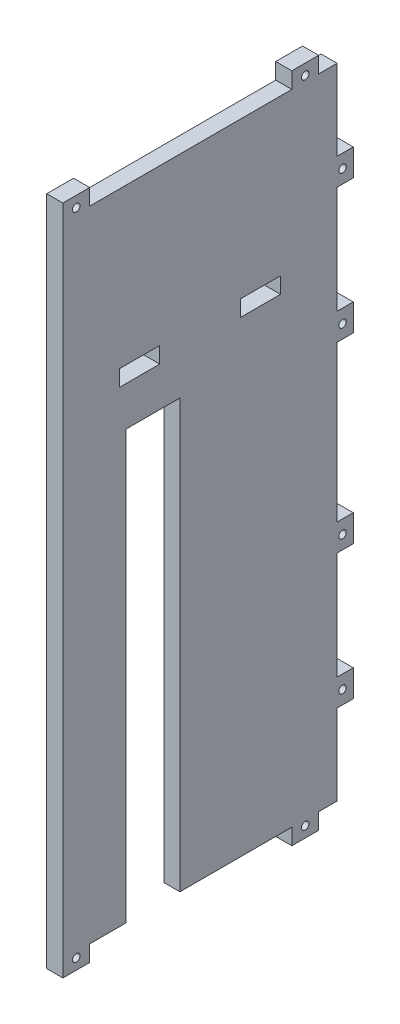
from build123d import *

# Parameters (mm, degrees)
ESQUISSE1_W             = 102.17
ESQUISSE1_H             = 238
ESQUISSE1_W_2           = 15
ESQUISSE1_H_2           = 6
BOSS_EXTRU_1_DEPTH      = 6
ESQUISSE3_W             = 10
ESQUISSE3_H             = 6
ESQUISSE3_W_2           = 6
ESQUISSE3_H_2           = 10
BOSS_EXTRU_5_DEPTH      = 6
ESQUISSE4_R             = 1.4
ENL_V_MAT_EXTRU_1_DEPTH = 6
ESQUISSE6_W             = 20
ESQUISSE6_H             = 159.29
ENL_V_MAT_EXTRU_2_DEPTH = 6


with BuildPart() as part:
    # Esquisse1 → Boss.-Extru.1 (new body)
    with BuildSketch(Plane(origin=(0, 0, 0), x_dir=(0, 0, -1), z_dir=(1, 0, 0))):
        Rectangle(ESQUISSE1_W, ESQUISSE1_H)
        with Locations((-22.5, 58)):
            Rectangle(ESQUISSE1_W_2, ESQUISSE1_H_2, mode=Mode.SUBTRACT)
        with Locations((22.5, 58)):
            Rectangle(ESQUISSE1_W_2, ESQUISSE1_H_2, mode=Mode.SUBTRACT)
    extrude(amount=BOSS_EXTRU_1_DEPTH)

    # Esquisse3 → Boss.-Extru.5 (add)
    with BuildSketch(Plane(origin=(6, 0, 0), x_dir=(0, 0, -1), z_dir=(1, 0, 0))):
        with Locations((-46.085, -122)):
            Rectangle(ESQUISSE3_W, ESQUISSE3_H)
        with Locations((39.205, -122)):
            Rectangle(ESQUISSE3_W, ESQUISSE3_H)
        with Locations((54.085, 84)):
            Rectangle(ESQUISSE3_W_2, ESQUISSE3_H_2)
        with Locations((54.085, 34)):
            Rectangle(ESQUISSE3_W_2, ESQUISSE3_H_2)
        with Locations((54.085, -34)):
            Rectangle(ESQUISSE3_W_2, ESQUISSE3_H_2)
        with Locations((54.085, -84)):
            Rectangle(ESQUISSE3_W_2, ESQUISSE3_H_2)
        with Locations((39.205, 122)):
            Rectangle(ESQUISSE3_W, ESQUISSE3_H)
        with Locations((-46.085, 122)):
            Rectangle(ESQUISSE3_W, ESQUISSE3_H)
    extrude(amount=-BOSS_EXTRU_5_DEPTH)

    # Esquisse4 → Enlèv. mat.-Extru.1 (cut)
    with BuildSketch(Plane(origin=(6, 0, 0), x_dir=(0, 0, -1), z_dir=(1, 0, 0))):
        with Locations((39.205, -121)):
            Circle(ESQUISSE4_R)
        with Locations((53.085, -84)):
            Circle(ESQUISSE4_R)
        with Locations((53.085, -34)):
            Circle(ESQUISSE4_R)
        with Locations((-46.085, 121)):
            Circle(ESQUISSE4_R)
        with Locations((53.085, 34)):
            Circle(ESQUISSE4_R)
        with Locations((53.085, 84)):
            Circle(ESQUISSE4_R)
        with Locations((39.205, 121)):
            Circle(ESQUISSE4_R)
        with Locations((-46.085, -121)):
            Circle(ESQUISSE4_R)
    extrude(amount=-ENL_V_MAT_EXTRU_1_DEPTH, mode=Mode.SUBTRACT)

    # Esquisse6 → Enlèv. mat.-Extru.2 (cut)
    with BuildSketch(Plane(origin=(6, 0, 0), x_dir=(0, 0, -1), z_dir=(1, 0, 0))):
        with Locations((-17.485, -39.355)):
            Rectangle(ESQUISSE6_W, ESQUISSE6_H)
    extrude(amount=-ENL_V_MAT_EXTRU_2_DEPTH, mode=Mode.SUBTRACT)


solid = part.part
